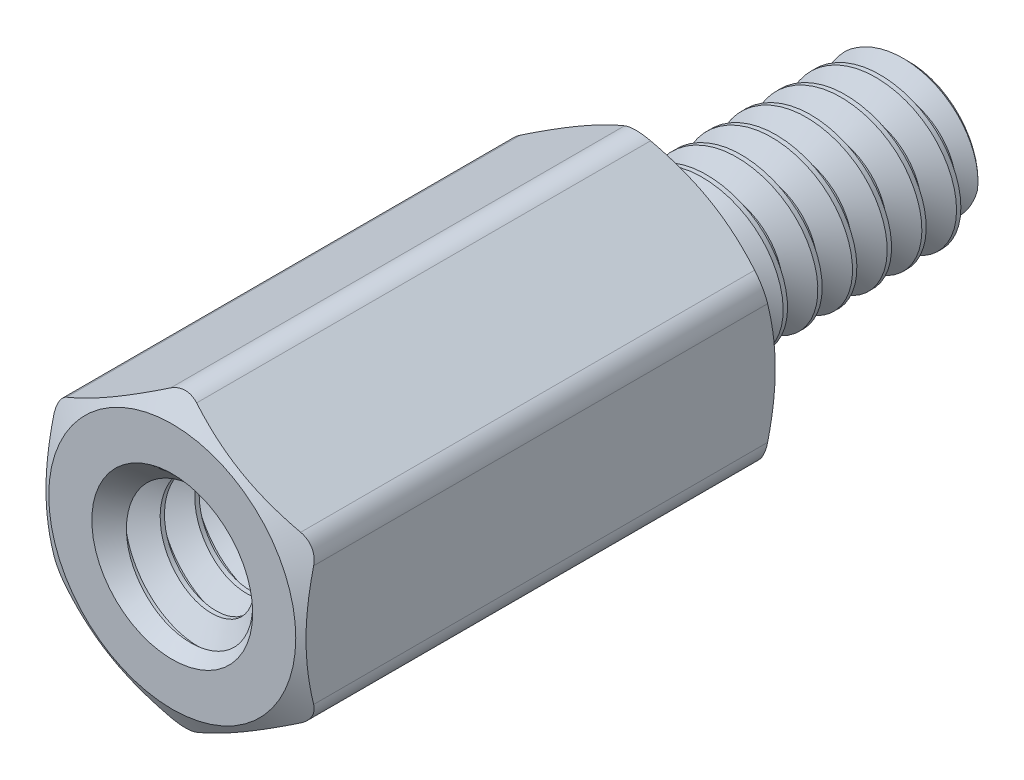
from build123d import *

# Parameters (mm, degrees)
SKETCH4_R           = 1.901825
BOSS_EXTRUDE1_DEPTH = 8.73125
SKETCH5_OUTSIDE_W   = 61.704
SKETCH5_OUTSIDE_H   = 62.442
SKETCH5_OUTSIDE_R   = 2.2621875
CUT_EXTRUDE1_DEPTH  = 14.975410884
CUT_EXTRUDE1_DRAFT  = -60
SKETCH6_OUTSIDE_W   = 46.058
SKETCH6_OUTSIDE_H   = 46.796
SKETCH6_OUTSIDE_R   = 2.2621875
CUT_EXTRUDE2_DEPTH  = 10.458622885
CUT_EXTRUDE2_DRAFT  = -60
FILLET1_R           = 0.47625
CUT_SWEEP1_PITCH    = 0.635
SKETCH9_R           = 1.58115
BOSS_EXTRUDE2_DEPTH = 6.35
SKETCH10_W          = 6.35
SKETCH10_H          = 1.4224
CUT_SWEEP2_PITCH    = 0.635


with BuildPart() as part:
    # Sketch3 → Revolve1 (revolve)
    with BuildSketch(Plane(origin=(0, 0, 0), x_dir=(0, 0, -1), z_dir=(1, 0, 0))):
        with BuildLine():
            Line((-2.38125, 1.26365), (-2.38125, 0))
            Line((-2.38125, 0), (4.7625, 0))
            Line((4.7625, 0), (4.7625, 1.26365))
            Line((4.7625, 1.26365), (4.60375, 1.4224))
            Line((4.60375, 1.4224), (0.809625, 1.4224))
            Line((0.809625, 1.4224), (0.5715, 1.009955401))
            Line((0.5715, 1.009955401), (0.15875, 1.009955401))
            ThreePointArc((0.15875, 1.009955401), (0.046496798, 1.0564522), (0, 1.168705401))
            Line((0, 1.168705401), (0, 2.38125))
            Line((0, 2.38125), (-8.73125, 2.38125))
            Line((-8.73125, 2.38125), (-8.73125, 1.58115))
            Line((-8.73125, 1.58115), (-8.5725, 1.4224))
            Line((-8.5725, 1.4224), (-2.54, 1.4224))
            Line((-2.54, 1.4224), (-2.38125, 1.26365))
        make_face()
    revolve(axis=Axis((0, 0, -4.7625), (0, 0, 1)))

    # Sketch4 → Boss-Extrude1 (add)
    with BuildSketch(Plane.XY.offset(8.73125)):
        Polygon((-2.38125, 1.374815329), (-2.38125, -1.374815329), (0, -2.749630657), (2.38125, -1.374815329), (2.38125, 1.374815329), (0, 2.749630657), align=None)
        Circle(SKETCH4_R, mode=Mode.SUBTRACT)
    extrude(amount=-BOSS_EXTRUDE1_DEPTH)


with BuildPart() as cut_extrude1_tool:
    # Sketch5 outside → Cut-Extrude1 (with draft: the straight prism first)
    with BuildSketch(Plane.XY.offset(8.73125)):
        Rectangle(SKETCH5_OUTSIDE_W, SKETCH5_OUTSIDE_H)
        Circle(SKETCH5_OUTSIDE_R, mode=Mode.SUBTRACT)
    extrude(amount=-CUT_EXTRUDE1_DEPTH)
    # Cut-Extrude1: the draft: its side faces are tilted about the plane it starts from
    cut_extrude1_sides = [cut_extrude1_tool.faces().sort_by_distance(p)[0] for p in [
        (0, -31.221, 1.243544558),
        (30.852, 0, 1.243544558),
        (0, 31.221, 1.243544558),
        (-30.852, 0, 1.243544558),
        (-2.2621875, 0, 1.243544558),
    ]]
    draft(cut_extrude1_sides, Plane.XY.offset(8.73125), CUT_EXTRUDE1_DRAFT)


with BuildPart() as part_1:
    add(part.part)

    # Cut-Extrude1: cut by cut_extrude1_tool
    add(cut_extrude1_tool.part, mode=Mode.SUBTRACT)


with BuildPart() as cut_extrude2_tool:
    # Sketch6 outside → Cut-Extrude2 (with draft: the straight prism first)
    with BuildSketch(Plane(origin=(0, 0, 0), x_dir=(-1, 0, 0), z_dir=(0, 0, -1))):
        Rectangle(SKETCH6_OUTSIDE_W, SKETCH6_OUTSIDE_H)
        Circle(SKETCH6_OUTSIDE_R, mode=Mode.SUBTRACT)
    extrude(amount=-CUT_EXTRUDE2_DEPTH)
    # Cut-Extrude2: the draft: its side faces are tilted about the plane it starts from
    cut_extrude2_sides = [cut_extrude2_tool.faces().sort_by_distance(p)[0] for p in [
        (0, -23.398, 5.229311442),
        (-23.029, 0, 5.229311442),
        (0, 23.398, 5.229311442),
        (23.029, 0, 5.229311442),
        (2.2621875, 0, 5.229311442),
    ]]
    draft(cut_extrude2_sides, Plane(origin=(0, 0, 0), x_dir=(-1, 0, 0), z_dir=(0, 0, -1)), CUT_EXTRUDE2_DRAFT)


with BuildPart() as part_2:
    add(part_1.part)

    # Cut-Extrude2: cut by cut_extrude2_tool
    add(cut_extrude2_tool.part, mode=Mode.SUBTRACT)

    # Fillet1
    fillet1_edges = [part_2.edges().sort_by_distance(p)[0] for p in [
        (0, 2.749630657, 4.365625),
        (-2.38125, -1.374815329, 4.365625),
        (0, -2.749630657, 4.365625),
        (2.38125, -1.374815329, 4.365625),
        (2.38125, 1.374815329, 4.365625),
        (-2.38125, 1.374815329, 4.365625),
    ]]
    fillet(fillet1_edges, radius=FILLET1_R)

    # Cut-Sweep1: the profile of Sketch7 profile screwed along a right-hand helix of 7.275 turns, 6 arcs to a turn; built about Z, then put on its axis
    cut_sweep1_z = Axis((0, 0, 0), (0, 0, 1))
    cut_sweep1_corners = [(1.009655401, 0, -0.238298205), (1.009655401, 0, -0.317326795), (1.456770383, 0, -0.57546875), (1.456770383, 0, 0.01984375)]
    with BuildLine(mode=Mode.PRIVATE) as cut_sweep1_profile:
        Line(cut_sweep1_corners[0], cut_sweep1_corners[1])
        Line(cut_sweep1_corners[1], cut_sweep1_corners[2])
        Line(cut_sweep1_corners[2], cut_sweep1_corners[3])
        Line(cut_sweep1_corners[3], cut_sweep1_corners[0])
    cut_sweep1_cap = Face(cut_sweep1_profile.wire())
    cut_sweep1_turn_angles = [0, 30, 60, 90, 120, 150, 180, 210, 240, 270, 300, 330, 360]
    cut_sweep1_turn_weights = [1, 0.8660254037844387, 1, 0.8660254037844387, 1, 0.8660254037844387, 1, 0.8660254037844387, 1, 0.8660254037844387, 1, 0.8660254037844387, 1]
    cut_sweep1_turn_rails = [Edge.make_bspline([Vector(p[0], p[1], 0).rotate(cut_sweep1_z, cut_sweep1_turn_angles[k]) / cut_sweep1_turn_weights[k] + Vector(0, 0, p[2] + CUT_SWEEP1_PITCH * cut_sweep1_turn_angles[k] / 360) for k in range(13)], [0, 0, 0, 1, 1, 2, 2, 3, 3, 4, 4, 5, 5, 6, 6, 6], 2, cut_sweep1_turn_weights) for p in cut_sweep1_corners]
    cut_sweep1_turn_sides = [Face.make_surface_from_curves(cut_sweep1_turn_rails[p[0]], cut_sweep1_turn_rails[p[1]]) for p in [(0, 1), (1, 2), (2, 3), (3, 0)]]
    cut_sweep1_last_angles = [2520, 2550, 2580, 2599.5, 2619]
    cut_sweep1_last_weights = [1, 0.8660254037844387, 1, 0.9426414910921744, 1]
    cut_sweep1_last_rails = [Edge.make_bspline([Vector(p[0], p[1], 0).rotate(cut_sweep1_z, cut_sweep1_last_angles[k]) / cut_sweep1_last_weights[k] + Vector(0, 0, p[2] + CUT_SWEEP1_PITCH * cut_sweep1_last_angles[k] / 360) for k in range(5)], [0, 0, 0, 1, 1, 2, 2, 2], 2, cut_sweep1_last_weights) for p in cut_sweep1_corners]
    cut_sweep1_last_sides = [Face.make_surface_from_curves(cut_sweep1_last_rails[p[0]], cut_sweep1_last_rails[p[1]]) for p in [(0, 1), (1, 2), (2, 3), (3, 0)]]
    cut_sweep1 = Plane(origin=(0, 0, -4.7625), x_dir=(0, 1, 0), z_dir=(0, 0, 1)) * Solid(Shell([*[p.moved(Location((0, 0, CUT_SWEEP1_PITCH * i))) for i in range(7) for p in cut_sweep1_turn_sides], *cut_sweep1_last_sides, cut_sweep1_cap, cut_sweep1_cap.rotate(cut_sweep1_z, 2619).moved(Location((0, 0, CUT_SWEEP1_PITCH * 2619 / 360)))]))
    add(cut_sweep1, mode=Mode.SUBTRACT)

    # Sketch9 → Boss-Extrude2 (add)
    with BuildSketch(Plane.XY.offset(2.38125)):
        Circle(SKETCH9_R)
    extrude(amount=BOSS_EXTRUDE2_DEPTH)


with BuildPart() as body_2:
    # Sketch10 → Revolve2 (revolve)
    with BuildSketch(Plane(origin=(0, 0, 0), x_dir=(0, 0, -1), z_dir=(1, 0, 0))):
        with Locations((-5.55625, 0.7112)):
            Rectangle(SKETCH10_W, SKETCH10_H)
    revolve(axis=Axis((0, 0, -4.7625), (0, 0, 1)))

    # Cut-Sweep2: the profile of Sketch12 profile screwed along a right-hand helix of 11 turns, 6 arcs to a turn; built about Z, then put on its axis
    cut_sweep2_z = Axis((0, 0, 0), (0, 0, 1))
    cut_sweep2_corners = [(1.009655401, 0, -0.317326795), (1.009655401, 0, -0.238298205), (1.456770383, 0, 0.01984375), (1.456770383, 0, -0.57546875)]
    with BuildLine(mode=Mode.PRIVATE) as cut_sweep2_profile:
        Line(cut_sweep2_corners[0], cut_sweep2_corners[1])
        Line(cut_sweep2_corners[1], cut_sweep2_corners[2])
        Line(cut_sweep2_corners[2], cut_sweep2_corners[3])
        Line(cut_sweep2_corners[3], cut_sweep2_corners[0])
    cut_sweep2_cap = Face(cut_sweep2_profile.wire())
    cut_sweep2_turn_angles = [0, 30, 60, 90, 120, 150, 180, 210, 240, 270, 300, 330, 360]
    cut_sweep2_turn_weights = [1, 0.8660254037844387, 1, 0.8660254037844387, 1, 0.8660254037844387, 1, 0.8660254037844387, 1, 0.8660254037844387, 1, 0.8660254037844387, 1]
    cut_sweep2_turn_rails = [Edge.make_bspline([Vector(p[0], p[1], 0).rotate(cut_sweep2_z, cut_sweep2_turn_angles[k]) / cut_sweep2_turn_weights[k] + Vector(0, 0, p[2] + CUT_SWEEP2_PITCH * cut_sweep2_turn_angles[k] / 360) for k in range(13)], [0, 0, 0, 1, 1, 2, 2, 3, 3, 4, 4, 5, 5, 6, 6, 6], 2, cut_sweep2_turn_weights) for p in cut_sweep2_corners]
    cut_sweep2_turn_sides = [Face.make_surface_from_curves(cut_sweep2_turn_rails[p[0]], cut_sweep2_turn_rails[p[1]]) for p in [(0, 1), (1, 2), (2, 3), (3, 0)]]
    cut_sweep2 = Plane(origin=(0, 0, 8.73125), x_dir=(0, 1, 0), z_dir=(0, 0, -1)) * Solid(Shell([*[p.moved(Location((0, 0, CUT_SWEEP2_PITCH * i))) for i in range(11) for p in cut_sweep2_turn_sides], cut_sweep2_cap, cut_sweep2_cap.rotate(cut_sweep2_z, 3960).moved(Location((0, 0, CUT_SWEEP2_PITCH * 3960 / 360)))]))
    add(cut_sweep2, mode=Mode.SUBTRACT)


with BuildPart() as part_3:
    add(part_2.part)

    # Combine1: cut body 2
    add(body_2.part, mode=Mode.SUBTRACT)

    # Cut-Extrude3 cone 1 section (through the dimple's axis) → Cut-Extrude3 (revolve, cut)
    with BuildSketch(Plane(origin=(0, 0, 8.73125), x_dir=(0, -1, 0), z_dir=(1, 0, 0))):
        Polygon((0, 0), (1.4732, 0), (0, 1.4732), align=None)
    revolve(axis=Axis((0, 0, 8.73125), (0, 0, -1)), mode=Mode.SUBTRACT)


solid = part_3.part
